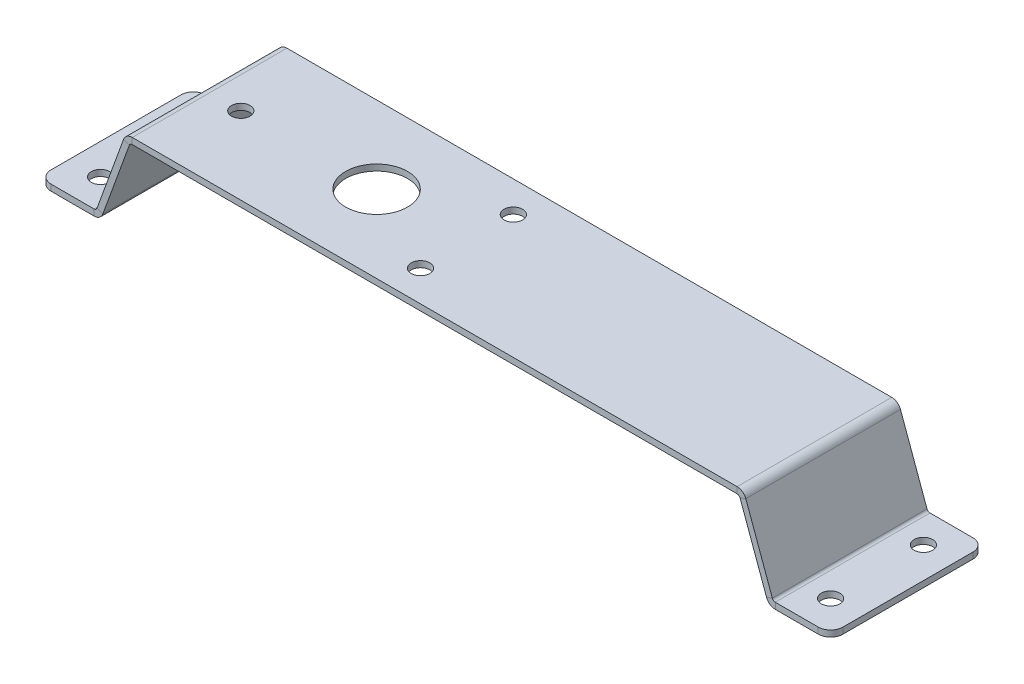
from build123d import *

# Parameters (mm, degrees)
SKETCH_1_W               = 100.6
SKETCH_1_H               = 25
EXTRUDE_1_DEPTH          = 1
SM_START                 = -12.5
SM_EDGE_FLANGE_1_DEPTH   = 25
SM_EDGE_FLANGE_1_2_DEPTH = 25
SM_EDGE_FLANGE_2_DEPTH   = 25
SM_EDGE_FLANGE_2_2_DEPTH = 25
SKETCH_18_R              = 1.5
CUT_EXTRUDE_1_DEPTH      = 1
SKETCH_19_R              = 1.5
CUT_EXTRUDE_2_DEPTH      = 1
FILLET_1_R               = 2
SKETCH_21_R              = 5
CUT_EXTRUDE_3_DEPTH      = 1
SKETCH_22_R              = 1.5
CUT_EXTRUDE_4_DEPTH      = 10


# Read off the part's stored shape, not the designer's step: Ребро-кромка1, Ребро-кромка2
with BuildPart() as part:
    # Sketch 1 → Бобышка-Вытянуть1 (new body)
    with BuildSketch(Plane(origin=(0, 0, 0), x_dir=(1, 0, 0), z_dir=(0, 1, 0))):
        Rectangle(SKETCH_1_W, SKETCH_1_H)
    extrude(amount=EXTRUDE_1_DEPTH)

    # Ребро-кромка1 outline → Ребро-кромка1 (cut)
    with BuildSketch(Plane.XY.offset(SM_START)):
        with BuildLine():
            Line((-50.3, 0), (-50.29525739, 0.013030215))
            ThreePointArc((-50.29525739, 0.013030215), (-49.746083113, 0.728728066), (-48.885718458, 1))
            Line((-48.885718458, 1), (-50.3, 1))
            Line((-50.3, 1), (-50.3, 0))
        make_face()
        with BuildLine():
            Line((50.3, 1), (48.885718458, 1))
            ThreePointArc((48.885718458, 1), (49.746083113, 0.728728066), (50.29525739, 0.013030215))
            Line((50.29525739, 0.013030215), (50.3, 0))
            Line((50.3, 0), (50.3, 1))
        make_face()
    extrude(amount=SM_EDGE_FLANGE_1_DEPTH, mode=Mode.SUBTRACT)

    # Sm Edge Flange 1 2 outline → Sm Edge Flange 1 2 (add)
    with BuildSketch(Plane.XY.offset(SM_START)):
        with BuildLine():
            Line((-48.885718458, 0), (-50.3, 0))
            Line((-50.3, 0), (-55.066331916, -13.095389312))
            Line((-55.066331916, -13.095389312), (-54.126639295, -13.437409455))
            Line((-54.126639295, -13.437409455), (-49.355564769, -0.328989928))
            ThreePointArc((-49.355564769, -0.328989928), (-49.172506676, -0.090423978), (-48.885718458, 0))
        make_face()
        with BuildLine():
            Line((50.3, 0), (48.885718458, 0))
            ThreePointArc((48.885718458, 0), (49.172506676, -0.090423978), (49.355564769, -0.328989928))
            Line((49.355564769, -0.328989928), (54.126639295, -13.437409455))
            Line((54.126639295, -13.437409455), (55.066331916, -13.095389312))
            Line((55.066331916, -13.095389312), (50.3, 0))
        make_face()
    extrude(amount=SM_EDGE_FLANGE_1_2_DEPTH)

    # Ребро-кромка2 outline → Ребро-кромка2 (cut)
    with BuildSketch(Plane.XY.offset(SM_START)):
        with BuildLine():
            Line((55.066331916, -13.095389312), (55.05246545, -13.095389312))
            ThreePointArc((55.05246545, -13.095389312), (54.192100796, -12.824117378), (53.642926519, -12.108419527))
            Line((53.642926519, -12.108419527), (54.126639295, -13.437409455))
            Line((54.126639295, -13.437409455), (55.066331916, -13.095389312))
        make_face()
        with BuildLine():
            Line((-55.05246545, -13.095389312), (-55.066331916, -13.095389312))
            Line((-55.066331916, -13.095389312), (-54.126639295, -13.437409455))
            Line((-54.126639295, -13.437409455), (-53.642926519, -12.108419527))
            ThreePointArc((-53.642926519, -12.108419527), (-54.192100796, -12.824117378), (-55.05246545, -13.095389312))
        make_face()
    extrude(amount=SM_EDGE_FLANGE_2_DEPTH, mode=Mode.SUBTRACT)

    # Sm Edge Flange 2 2 outline → Sm Edge Flange 2 2 (add)
    with BuildSketch(Plane.XY.offset(SM_START)):
        with BuildLine():
            Line((54.58261914, -11.766399383), (55.066331916, -13.095389312))
            Line((55.066331916, -13.095389312), (64.002154143, -13.095389312))
            Line((64.002154143, -13.095389312), (64.002154143, -12.095389312))
            Line((64.002154143, -12.095389312), (55.05246545, -12.095389312))
            ThreePointArc((55.05246545, -12.095389312), (54.765677232, -12.004965334), (54.58261914, -11.766399383))
        make_face()
        with BuildLine():
            Line((-64.002154143, -12.095389312), (-64.002154143, -13.095389312))
            Line((-64.002154143, -13.095389312), (-55.066331916, -13.095389312))
            Line((-55.066331916, -13.095389312), (-54.58261914, -11.766399383))
            ThreePointArc((-54.58261914, -11.766399383), (-54.765677232, -12.004965334), (-55.05246545, -12.095389312))
            Line((-55.05246545, -12.095389312), (-64.002154143, -12.095389312))
        make_face()
    extrude(amount=SM_EDGE_FLANGE_2_2_DEPTH)

    # Эскиз18 → Вырез-Вытянуть1 (cut)
    with BuildSketch(Plane(origin=(0, 1, 0), x_dir=(1, 0, 0), z_dir=(0, 1, 0))):
        with Locations(Location((-7.285718458, 7.5, 0), (0, 0, 270))):
            Circle(SKETCH_18_R)
        with Locations(Location((-7.285718458, -7.5, 0), (0, 0, 90))):
            Circle(SKETCH_18_R)
    extrude(amount=-CUT_EXTRUDE_1_DEPTH, mode=Mode.SUBTRACT)

    # Эскиз19 → Вырез-Вытянуть2 (cut)
    with BuildSketch(Plane(origin=(0, -12.095389312, 0), x_dir=(1, 0, 0), z_dir=(0, 1, 0))):
        with Locations(Location((59.002154143, 7.5, 0), (0, 0, 270))):
            Circle(SKETCH_19_R)
        with Locations(Location((59.002154143, -7.5, 0), (0, 0, 90))):
            Circle(SKETCH_19_R)
        with Locations(Location((-59.002154143, -7.5, 0), (0, 0, 270))):
            Circle(SKETCH_19_R)
        with Locations(Location((-59.002154143, 7.5, 0), (0, 0, 90))):
            Circle(SKETCH_19_R)
    extrude(amount=-CUT_EXTRUDE_2_DEPTH, mode=Mode.SUBTRACT)

    # Скругление1
    fillet_1_edges = [part.edges().sort_by_distance(p)[0] for p in [
        (64.002154143, -12.595389312, 12.5),
        (64.002154143, -12.595389312, -12.5),
        (-64.002154143, -12.595389312, -12.5),
        (-64.002154143, -12.595389312, 12.5),
    ]]
    fillet(fillet_1_edges, radius=FILLET_1_R)

    # Эскиз21 → Вырез-Вытянуть3 (cut)
    with BuildSketch(Plane(origin=(0, 1, 0), x_dir=(1, 0, 0), z_dir=(0, 1, 0))):
        with Locations(Location((-21.885718458, 0, 0), (0, 0, 270))):
            Circle(SKETCH_21_R)
    extrude(amount=-CUT_EXTRUDE_3_DEPTH, mode=Mode.SUBTRACT)

    # Эскиз22 → Вырез-Вытянуть4 (cut)
    with BuildSketch(Plane(origin=(0, 1, 0), x_dir=(1, 0, 0), z_dir=(0, 1, 0))):
        with Locations(Location((-43.835718458, 0, 0), (0, 0, 270))):
            Circle(SKETCH_22_R)
    extrude(amount=-CUT_EXTRUDE_4_DEPTH, mode=Mode.SUBTRACT)


solid = part.part
